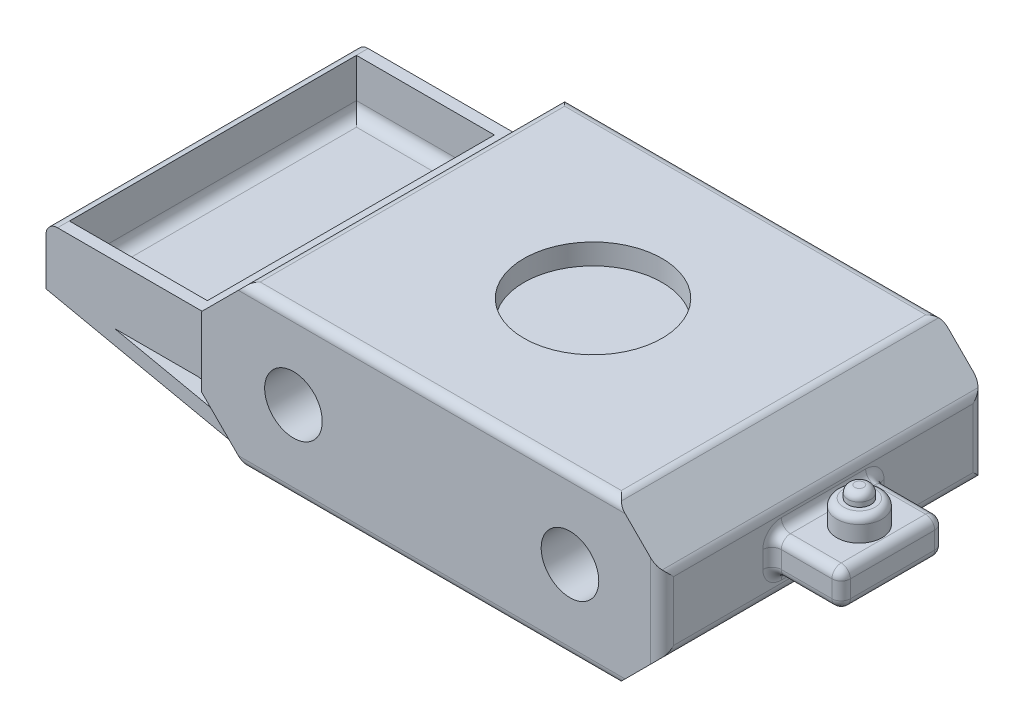
from build123d import *

# Parameters (mm, degrees)
SKETCH3_W           = 355.6
SKETCH3_H           = 177.8
BOSS_EXTRUDE1_DEPTH = 508
SKETCH4_R           = 31.75
CUT_EXTRUDE1_DEPTH  = 627.433212721
CHAMFER1_START      = -64
CHAMFER1_OUTLINE_W  = 75
CHAMFER1_OUTLINE_H  = 358
CHAMFER1_DEPTH      = 37.059231637
CHAMFER2_START      = -64
CHAMFER2_OUTLINE_W  = 75
CHAMFER2_OUTLINE_H  = 358
CHAMFER2_DEPTH      = 37.059231637
CHAMFER3_START      = 386.151013206
CHAMFER3_OUTLINE_W  = 75
CHAMFER3_OUTLINE_H  = 358
CHAMFER3_DEPTH      = 36.848986794
CHAMFER4_START      = 386.151013206
CHAMFER4_OUTLINE_W  = 75
CHAMFER4_OUTLINE_H  = 358
CHAMFER4_DEPTH      = 36.848986794
FILLET1_R           = 10
SKETCH5_R           = 76.2
CUT_EXTRUDE2_DEPTH  = 22.86
SKETCH7_W           = 342.323707946
SKETCH7_H           = 64.688657288
BOSS_EXTRUDE3_DEPTH = 177.8
SKETCH8_W           = 152.017430594
SKETCH8_H           = 316.368655432
CUT_EXTRUDE3_DEPTH  = 55.88
BOSS_EXTRUDE5_DEPTH = 55.88
SKETCH11_W          = 113.282529032
SKETCH11_H          = 39.308418544
BOSS_EXTRUDE6_DEPTH = 76.2
FILLET2_R           = 10.16
FILLET3_R           = 12.7
FILLET4_R           = 12.7
FILLET5_R           = 12.7
SKETCH12_R          = 24.948838793
BOSS_EXTRUDE7_DEPTH = 25.4
FILLET6_R           = 7.62
SKETCH13_R          = 12.609032653
BOSS_EXTRUDE8_DEPTH = 12.7
FILLET7_R           = 7.62


with BuildPart() as part:
    # Sketch3 → Boss-Extrude1 (new body)
    with BuildSketch(Plane(origin=(0, 0, 0), x_dir=(0, 0, -1), z_dir=(1, 0, 0))):
        Rectangle(SKETCH3_W, SKETCH3_H)
    extrude(amount=BOSS_EXTRUDE1_DEPTH)

    # Sketch4 → Cut-Extrude1 (cut, symmetric)
    with BuildSketch(Plane.XY.offset(177.8)):
        with Locations((101.6, 0)):
            Circle(SKETCH4_R)
    cut_extrude1 = extrude(amount=CUT_EXTRUDE1_DEPTH, both=True, mode=Mode.SUBTRACT)

    # Mirror1: Cut-Extrude1 across plane
    add(cut_extrude1.mirror(Plane.ZY.offset(-254)), mode=Mode.SUBTRACT)

    # Chamfer1: read off the stored shape, not the designer's step
    # Chamfer1 outline → Chamfer1 (cut)
    with BuildSketch(Plane(origin=(0, 0, 0), x_dir=(0.7071067811865471, 0.707106781186548, 0), z_dir=(0.707106781186548, -0.707106781186547, 0)).offset(CHAMFER1_START)):
        with Locations((62.5, 0)):
            Rectangle(CHAMFER1_OUTLINE_W, CHAMFER1_OUTLINE_H)
    extrude(amount=CHAMFER1_DEPTH, mode=Mode.SUBTRACT)

    # Chamfer2: read off the stored shape, not the designer's step
    # Chamfer2 outline → Chamfer2 (cut)
    with BuildSketch(Plane(origin=(0, 0, 0), x_dir=(0.707106781186548, -0.707106781186547, 0), z_dir=(0.707106781186547, 0.707106781186548, 0)).offset(CHAMFER2_START)):
        with Locations((62.5, 0)):
            Rectangle(CHAMFER2_OUTLINE_W, CHAMFER2_OUTLINE_H)
    extrude(amount=CHAMFER2_DEPTH, mode=Mode.SUBTRACT)

    # Chamfer3: read off the stored shape, not the designer's step
    # Chamfer3 outline → Chamfer3 (cut)
    with BuildSketch(Plane(origin=(0, 0, 0), x_dir=(0.707106781186548, -0.707106781186547, 0), z_dir=(0.707106781186547, 0.707106781186548, 0)).offset(CHAMFER3_START)):
        with Locations((296.5, 0)):
            Rectangle(CHAMFER3_OUTLINE_W, CHAMFER3_OUTLINE_H)
    extrude(amount=CHAMFER3_DEPTH, mode=Mode.SUBTRACT)

    # Chamfer4: read off the stored shape, not the designer's step
    # Chamfer4 outline → Chamfer4 (cut)
    with BuildSketch(Plane(origin=(0, 0, 0), x_dir=(0.707106781186548, 0.707106781186547, 0), z_dir=(0.707106781186547, -0.707106781186548, 0)).offset(CHAMFER4_START)):
        with Locations((296.5, 0)):
            Rectangle(CHAMFER4_OUTLINE_W, CHAMFER4_OUTLINE_H)
    extrude(amount=CHAMFER4_DEPTH, mode=Mode.SUBTRACT)

    # Fillet1
    fillet1_edges = [part.edges().sort_by_distance(p)[0] for p in [
        (50.8, 88.9, 0),
        (50.8, -88.9, 0),
        (254, 88.9, -177.8),
        (254, 88.9, 177.8),
        (457.2, 88.9, 0),
        (254, -88.9, 177.8),
        (254, -88.9, -177.8),
        (457.2, -88.9, 0),
    ]]
    fillet(fillet1_edges, radius=FILLET1_R)

    # Sketch5 → Cut-Extrude2 (cut)
    with BuildSketch(Plane(origin=(0, 88.9, 0), x_dir=(1, 0, 0), z_dir=(0, 1, 0))):
        with Locations(Location((254, 0, 0), (0, 0, 270))):
            Circle(SKETCH5_R)
    extrude(amount=-CUT_EXTRUDE2_DEPTH, mode=Mode.SUBTRACT)

    # Sketch7 → Boss-Extrude3 (add)
    with BuildSketch(Plane.ZY):
        Rectangle(SKETCH7_W, SKETCH7_H)
    extrude(amount=BOSS_EXTRUDE3_DEPTH)

    # Sketch8 → Cut-Extrude3 (cut)
    with BuildSketch(Plane(origin=(0, 32.344328644, 0), x_dir=(1, 0, 0), z_dir=(0, 1, 0))):
        with Locations((-88.9, 0)):
            Rectangle(SKETCH8_W, SKETCH8_H)
    extrude(amount=-CUT_EXTRUDE3_DEPTH, mode=Mode.SUBTRACT)

    # Sketch10 → Boss-Extrude5 (add)
    with BuildSketch(Plane.XY.offset(171.161853973)):
        Polygon((-177.8, -32.344328644), (40.8, -78.9), (20.4, -58.5), (-102.412744224, -32.344328644), align=None)
    boss_extrude5 = extrude(amount=-BOSS_EXTRUDE5_DEPTH)

    # Mirror2: Boss-Extrude5 across plane
    add(boss_extrude5.mirror(Plane.XY))

    # Sketch11 → Boss-Extrude6 (add)
    with BuildSketch(Plane(origin=(508, 0, 0), x_dir=(0, 0, -1), z_dir=(1, 0, 0))):
        Rectangle(SKETCH11_W, SKETCH11_H)
    extrude(amount=BOSS_EXTRUDE6_DEPTH)

    # Fillet2
    fillet2_edges = [part.edges().sort_by_distance(p)[0] for p in [
        (508, 0, -56.641264516),
        (546.1, -19.654209272, -56.641264516),
        (508, 19.654209272, 0),
        (546.1, 19.654209272, -56.641264516),
        (508, 0, 56.641264516),
        (546.1, 19.654209272, 56.641264516),
        (508, -19.654209272, 0),
        (546.1, -19.654209272, 56.641264516),
        (584.2, 0, -56.641264516),
        (584.2, 19.654209272, 0),
        (584.2, 0, 56.641264516),
        (584.2, -19.654209272, 0),
    ]]
    fillet(fillet2_edges, radius=FILLET2_R)

    # Fillet3
    fillet3_edges = [part.edges().sort_by_distance(p)[0] for p in [
        (508, 0, 177.8),
        (508, 38.1, 0),
        (508, 0, -177.8),
        (508, -38.1, 0),
    ]]
    fillet(fillet3_edges, radius=FILLET3_R)

    # Fillet4
    # the kernel refuses this fillet: 12.7 mm, written as the material it adds along each edge
    with BuildSketch(Plane(origin=(0, -32.344328644, 171.161853973), x_dir=(-1.269692375710673e-12, -1.0, 0), z_dir=(0, 0, -1))) as fillet4_piece_1:
        with BuildLine():
            CenterArc((12.7, 10.63326383), FILLET4_R, 180, 56.852413593)
            Line((0, 10.63326383), (-0.254, 10.63326383))
            Line((-0.254, 10.63326383), (-0.254, 0))
            Line((-0.254, 0), (0, -0.254))
            ThreePointArc((0, -0.254), (2.877835678, -0.254), (5.616784783, -0.212665277))
            Line((5.616784783, -0.212665277), (5.755671356, 0))
        make_face()
    extrude(amount=342.323707946)
    with BuildSketch(Plane(origin=(-12.891284703, -23.535671356, -158.184327716), x_dir=(0, 1, 0), z_dir=(0, 0, 1)), Plane(origin=(-164.908715297, -23.535671356, 158.184327716), x_dir=(0, 1, 0), z_dir=(0, 0, -1))) as fillet4_piece_2:
        with BuildLine():
            CenterArc((FILLET4_R, FILLET4_R), FILLET4_R, 180, 90)
            Line((0, FILLET4_R), (-FILLET4_R * 0.02, FILLET4_R))
            Line((-FILLET4_R * 0.02, FILLET4_R), (-FILLET4_R * 0.02, -FILLET4_R * 0.02))
            Line((-FILLET4_R * 0.02, -FILLET4_R * 0.02), (FILLET4_R, -FILLET4_R * 0.02))
            Line((FILLET4_R, -FILLET4_R * 0.02), (FILLET4_R, 0))
        make_face()
    extrude(amount=316.368655432)
    with BuildSketch(Plane(origin=(18.858715297, -23.535671356, 158.184327716), x_dir=(0, 1, 0), z_dir=(-1, 0, 0)), Plane(origin=(-164.908715297, -23.535671356, -158.184327716), x_dir=(0, 1, 0), z_dir=(1, 0, 0))) as fillet4_piece_3:
        with BuildLine():
            CenterArc((FILLET4_R, FILLET4_R), FILLET4_R, 180, 90)
            Line((0, FILLET4_R), (-FILLET4_R * 0.02, FILLET4_R))
            Line((-FILLET4_R * 0.02, FILLET4_R), (-FILLET4_R * 0.02, -FILLET4_R * 0.02))
            Line((-FILLET4_R * 0.02, -FILLET4_R * 0.02), (FILLET4_R, -FILLET4_R * 0.02))
            Line((FILLET4_R, -FILLET4_R * 0.02), (FILLET4_R, 0))
        make_face()
    extrude(amount=183.767430594)
    with BuildSketch(Plane(origin=(-164.908715297, -23.535671356, 189.934327716), x_dir=(0, 1, 0), z_dir=(0, 0, -1))) as fillet4_piece_4a_section:
        with BuildLine():
            CenterArc((FILLET4_R, FILLET4_R), FILLET4_R, 180, 90)
            Line((0, FILLET4_R), (-FILLET4_R * 0.02, FILLET4_R))
            Line((-FILLET4_R * 0.02, FILLET4_R), (-FILLET4_R * 0.02, -FILLET4_R * 0.02))
            Line((-FILLET4_R * 0.02, -FILLET4_R * 0.02), (FILLET4_R, -FILLET4_R * 0.02))
            Line((FILLET4_R, -FILLET4_R * 0.02), (FILLET4_R, 0))
        make_face()
    fillet4_piece_4a = extrude(amount=348.118655432, mode=Mode.PRIVATE)
    fillet4_piece_4a = split(fillet4_piece_4a, bisect_by=Plane(origin=(-164.908715297, -23.535671356, 158.184327716), z_dir=(0, 0, 1)), keep=Keep.TOP, mode=Mode.PRIVATE)
    with BuildSketch(Plane(origin=(-12.891284703, -23.535671356, 158.184327716), x_dir=(0, 1, 0), z_dir=(-1, 0, 0))) as fillet4_piece_4b_section:
        with BuildLine():
            CenterArc((FILLET4_R, FILLET4_R), FILLET4_R, 180, 90)
            Line((0, FILLET4_R), (-FILLET4_R * 0.02, FILLET4_R))
            Line((-FILLET4_R * 0.02, FILLET4_R), (-FILLET4_R * 0.02, -FILLET4_R * 0.02))
            Line((-FILLET4_R * 0.02, -FILLET4_R * 0.02), (FILLET4_R, -FILLET4_R * 0.02))
            Line((FILLET4_R, -FILLET4_R * 0.02), (FILLET4_R, 0))
        make_face()
    fillet4_piece_4b = extrude(amount=183.767430594, mode=Mode.PRIVATE)
    fillet4_piece_4b = split(fillet4_piece_4b, bisect_by=Plane(origin=(-164.908715297, -23.535671356, 158.184327716), z_dir=(-1, 0, 0)), keep=Keep.TOP, mode=Mode.PRIVATE)
    fillet4_piece_4 = fillet4_piece_4a & fillet4_piece_4b
    add(fillet4_piece_4)
    with BuildSketch(Plane(origin=(-164.908715297, -23.535671356, 158.184327716), x_dir=(0, 1, 0), z_dir=(0, 0, -1))) as fillet4_piece_5a_section:
        with BuildLine():
            CenterArc((FILLET4_R, FILLET4_R), FILLET4_R, 180, 90)
            Line((0, FILLET4_R), (-FILLET4_R * 0.02, FILLET4_R))
            Line((-FILLET4_R * 0.02, FILLET4_R), (-FILLET4_R * 0.02, -FILLET4_R * 0.02))
            Line((-FILLET4_R * 0.02, -FILLET4_R * 0.02), (FILLET4_R, -FILLET4_R * 0.02))
            Line((FILLET4_R, -FILLET4_R * 0.02), (FILLET4_R, 0))
        make_face()
    fillet4_piece_5a = extrude(amount=348.118655432, mode=Mode.PRIVATE)
    fillet4_piece_5a = split(fillet4_piece_5a, bisect_by=Plane(origin=(-164.908715297, -23.535671356, -158.184327716), z_dir=(0, 0, -1)), keep=Keep.TOP, mode=Mode.PRIVATE)
    with BuildSketch(Plane(origin=(-196.658715297, -23.535671356, -158.184327716), x_dir=(0, 1, 0), z_dir=(1, 0, 0))) as fillet4_piece_5b_section:
        with BuildLine():
            CenterArc((FILLET4_R, FILLET4_R), FILLET4_R, 180, 90)
            Line((0, FILLET4_R), (-FILLET4_R * 0.02, FILLET4_R))
            Line((-FILLET4_R * 0.02, FILLET4_R), (-FILLET4_R * 0.02, -FILLET4_R * 0.02))
            Line((-FILLET4_R * 0.02, -FILLET4_R * 0.02), (FILLET4_R, -FILLET4_R * 0.02))
            Line((FILLET4_R, -FILLET4_R * 0.02), (FILLET4_R, 0))
        make_face()
    fillet4_piece_5b = extrude(amount=183.767430594, mode=Mode.PRIVATE)
    fillet4_piece_5b = split(fillet4_piece_5b, bisect_by=Plane(origin=(-164.908715297, -23.535671356, -158.184327716), z_dir=(-1, 0, 0)), keep=Keep.TOP, mode=Mode.PRIVATE)
    fillet4_piece_5 = fillet4_piece_5a & fillet4_piece_5b
    add(fillet4_piece_5)

    # Fillet5
    fillet5_edges = [part.edges().sort_by_distance(p)[0] for p in [
        (-177.8, 32.344328644, 0),
    ]]
    fillet(fillet5_edges, radius=FILLET5_R)

    # Sketch12 → Boss-Extrude7 (add)
    with BuildSketch(Plane(origin=(0, 19.654209272, 0), x_dir=(1, 0, 0), z_dir=(0, 1, 0))):
        with Locations(Location((547.607631205, 0, 0), (0, 0, 90))):
            Circle(SKETCH12_R)
    extrude(amount=BOSS_EXTRUDE7_DEPTH)

    # Fillet6
    fillet6_edges = [part.edges().sort_by_distance(p)[0] for p in [
        (547.607631205, 45.054209272, 24.948838793),
    ]]
    fillet(fillet6_edges, radius=FILLET6_R)

    # Sketch13 → Boss-Extrude8 (add)
    with BuildSketch(Plane(origin=(0, 45.054209272, 0), x_dir=(1, 0, 0), z_dir=(0, 1, 0))):
        with Locations(Location((547.607631205, 0, 0), (0, 0, 270))):
            Circle(SKETCH13_R)
    extrude(amount=BOSS_EXTRUDE8_DEPTH)

    # Fillet7
    fillet7_edges = [part.edges().sort_by_distance(p)[0] for p in [
        (547.607631205, 57.754209272, -12.609032653),
    ]]
    fillet(fillet7_edges, radius=FILLET7_R)


solid = part.part
